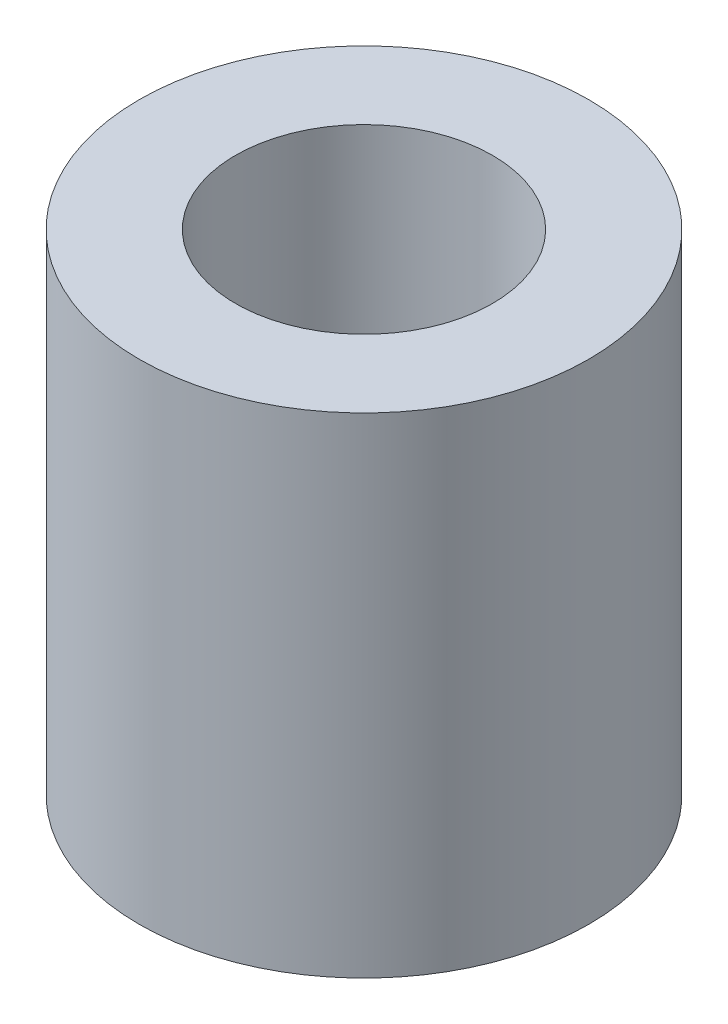
from build123d import *

# Parameters (mm, degrees)
SKETCH1_R           = 35
SKETCH1_R_2         = 20
BOSS_EXTRUDE1_DEPTH = 76.2


with BuildPart() as part:
    # Sketch1 → Boss-Extrude1 (new body)
    with BuildSketch(Plane(origin=(0, 0, 0), x_dir=(1, 0, 0), z_dir=(0, 1, 0))):
        Circle(SKETCH1_R)
        Circle(SKETCH1_R_2, mode=Mode.SUBTRACT)
    extrude(amount=BOSS_EXTRUDE1_DEPTH)


solid = part.part
